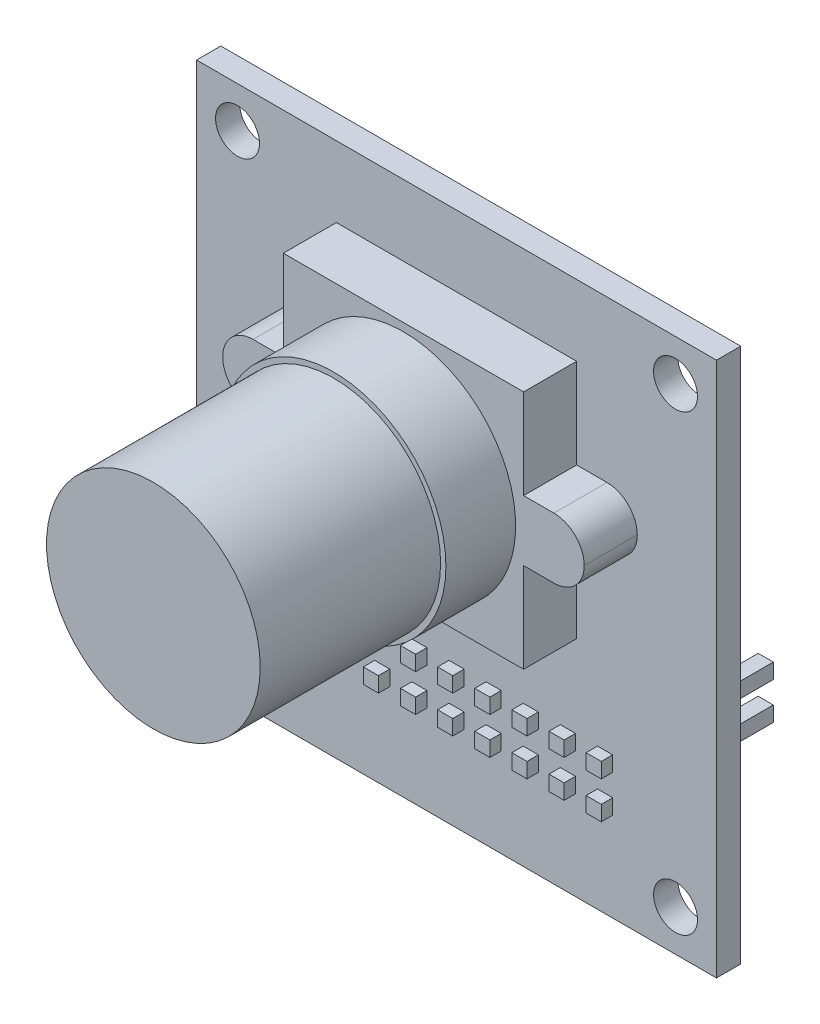
from build123d import *

# Parameters (mm, degrees)
SKETCH1_W           = 34.3
SKETCH1_H           = 35.3
BOSS_EXTRUDE1_DEPTH = 1.6
SKETCH2_W           = 22.6
SKETCH2_H           = 5
BOSS_EXTRUDE2_DEPTH = 3
SKETCH3_W           = 1
SKETCH3_H           = 1
BOSS_EXTRUDE3_DEPTH = 6
SKETCH4_R           = 7.05
BOSS_EXTRUDE4_DEPTH = 20
SKETCH5_R           = 7.4
BOSS_EXTRUDE5_DEPTH = 8.1
BOSS_EXTRUDE6_DEPTH = 3.5
FILLET1_R           = 2
SKETCH7_W           = 1
SKETCH7_H           = 1
BOSS_EXTRUDE7_DEPTH = 0.75
SKETCH8_R           = 1.45
CUT_EXTRUDE1_DEPTH  = 35.776608518


with BuildPart() as part:
    # Sketch1 → Boss-Extrude1 (new body)
    with BuildSketch(Plane.XY):
        with Locations((0, -5.05)):
            Rectangle(SKETCH1_W, SKETCH1_H)
    extrude(amount=BOSS_EXTRUDE1_DEPTH)

    # Sketch2 → Boss-Extrude2 (add)
    with BuildSketch(Plane(origin=(0, 0, 0), x_dir=(-1, 0, 0), z_dir=(0, 0, -1))):
        with Locations((0, -15.1)):
            Rectangle(SKETCH2_W, SKETCH2_H)
    extrude(amount=BOSS_EXTRUDE2_DEPTH)

    # Sketch3 → Boss-Extrude3 (add)
    with BuildSketch(Plane(origin=(0, 0, -3), x_dir=(-1, 0, 0), z_dir=(0, 0, -1))):
        with Locations((-7.35, -16.325)):
            Rectangle(SKETCH3_W, SKETCH3_H)
        with Locations((-9.8, -16.325)):
            Rectangle(SKETCH3_W, SKETCH3_H)
        with Locations((-4.9, -16.325)):
            Rectangle(SKETCH3_W, SKETCH3_H)
        with Locations((-2.45, -16.325)):
            Rectangle(SKETCH3_W, SKETCH3_H)
        with Locations((0, -16.325)):
            Rectangle(SKETCH3_W, SKETCH3_H)
        with Locations((2.45, -16.325)):
            Rectangle(SKETCH3_W, SKETCH3_H)
        with Locations((4.9, -16.325)):
            Rectangle(SKETCH3_W, SKETCH3_H)
        with Locations((7.35, -16.325)):
            Rectangle(SKETCH3_W, SKETCH3_H)
        with Locations((9.8, -16.325)):
            Rectangle(SKETCH3_W, SKETCH3_H)
        with Locations((-7.35, -13.875)):
            Rectangle(SKETCH3_W, SKETCH3_H)
        with Locations((-4.9, -13.875)):
            Rectangle(SKETCH3_W, SKETCH3_H)
        with Locations((-2.45, -13.875)):
            Rectangle(SKETCH3_W, SKETCH3_H)
        with Locations((0, -13.875)):
            Rectangle(SKETCH3_W, SKETCH3_H)
        with Locations((2.45, -13.875)):
            Rectangle(SKETCH3_W, SKETCH3_H)
        with Locations((4.9, -13.875)):
            Rectangle(SKETCH3_W, SKETCH3_H)
        with Locations((7.35, -13.875)):
            Rectangle(SKETCH3_W, SKETCH3_H)
        with Locations((9.8, -13.875)):
            Rectangle(SKETCH3_W, SKETCH3_H)
        with Locations((-9.8, -13.875)):
            Rectangle(SKETCH3_W, SKETCH3_H)
    extrude(amount=BOSS_EXTRUDE3_DEPTH)

    # Sketch4 → Boss-Extrude4 (add)
    with BuildSketch(Plane.XY.offset(1.6)):
        Circle(SKETCH4_R)
    extrude(amount=BOSS_EXTRUDE4_DEPTH)

    # Sketch5 → Boss-Extrude5 (add)
    with BuildSketch(Plane.XY.offset(1.6)):
        with Locations(Location((0, 0, 0), (0, 0, 180))):
            Circle(SKETCH5_R)
    extrude(amount=BOSS_EXTRUDE5_DEPTH)

    # Sketch6 → Boss-Extrude6 (add)
    with BuildSketch(Plane.XY.offset(1.6)):
        Polygon((7.925, 7.925), (-7.925, 7.925), (-7.925, 2), (-11.925, 2), (-11.925, -2), (-7.925, -2), (-7.925, -7.925), (7.925, -7.925), (7.925, -2), (11.925, -2), (11.925, 2), (7.925, 2), align=None)
    extrude(amount=BOSS_EXTRUDE6_DEPTH)

    # Fillet1
    fillet1_edges = [part.edges().sort_by_distance(p)[0] for p in [
        (11.925, 2, 3.35),
        (11.925, -2, 3.35),
        (-11.925, 2, 3.35),
        (-11.925, -2, 3.35),
    ]]
    fillet(fillet1_edges, radius=FILLET1_R - 0.0001)  # a hair under: the kernel refuses the full size

    # Sketch7 → Boss-Extrude7 (add)
    with BuildSketch(Plane.XY.offset(1.6)):
        with Locations((4.9, -16.325)):
            Rectangle(SKETCH7_W, SKETCH7_H)
        with Locations((9.8, -16.325)):
            Rectangle(SKETCH7_W, SKETCH7_H)
        with Locations((7.35, -16.325)):
            Rectangle(SKETCH7_W, SKETCH7_H)
        with Locations((-4.9, -16.325)):
            Rectangle(SKETCH7_W, SKETCH7_H)
        with Locations((-2.45, -16.325)):
            Rectangle(SKETCH7_W, SKETCH7_H)
        with Locations((0, -16.325)):
            Rectangle(SKETCH7_W, SKETCH7_H)
        with Locations((2.45, -16.325)):
            Rectangle(SKETCH7_W, SKETCH7_H)
        with Locations((-9.8, -16.325)):
            Rectangle(SKETCH7_W, SKETCH7_H)
        with Locations((-7.35, -16.325)):
            Rectangle(SKETCH7_W, SKETCH7_H)
        with Locations((4.9, -13.875)):
            Rectangle(SKETCH7_W, SKETCH7_H)
        with Locations((7.35, -13.875)):
            Rectangle(SKETCH7_W, SKETCH7_H)
        with Locations((-4.9, -13.875)):
            Rectangle(SKETCH7_W, SKETCH7_H)
        with Locations((-2.45, -13.875)):
            Rectangle(SKETCH7_W, SKETCH7_H)
        with Locations((0, -13.875)):
            Rectangle(SKETCH7_W, SKETCH7_H)
        with Locations((2.45, -13.875)):
            Rectangle(SKETCH7_W, SKETCH7_H)
        with Locations((9.8, -13.875)):
            Rectangle(SKETCH7_W, SKETCH7_H)
        with Locations((-9.8, -13.875)):
            Rectangle(SKETCH7_W, SKETCH7_H)
        with Locations((-7.35, -13.875)):
            Rectangle(SKETCH7_W, SKETCH7_H)
    extrude(amount=BOSS_EXTRUDE7_DEPTH)

    # Sketch8 → Cut-Extrude1 (cut, through all)
    with BuildSketch(Plane.XY.offset(1.6)):
        with Locations((-14.45, 9.9)):
            Circle(SKETCH8_R)
        with Locations(Location((-14.45, -20, 0), (0, 0, 180))):
            Circle(SKETCH8_R)
        with Locations((14.45, -20)):
            Circle(SKETCH8_R)
        with Locations(Location((14.45, 9.9, 0), (0, 0, 180))):
            Circle(SKETCH8_R)
    extrude(amount=-CUT_EXTRUDE1_DEPTH, mode=Mode.SUBTRACT)


solid = part.part
